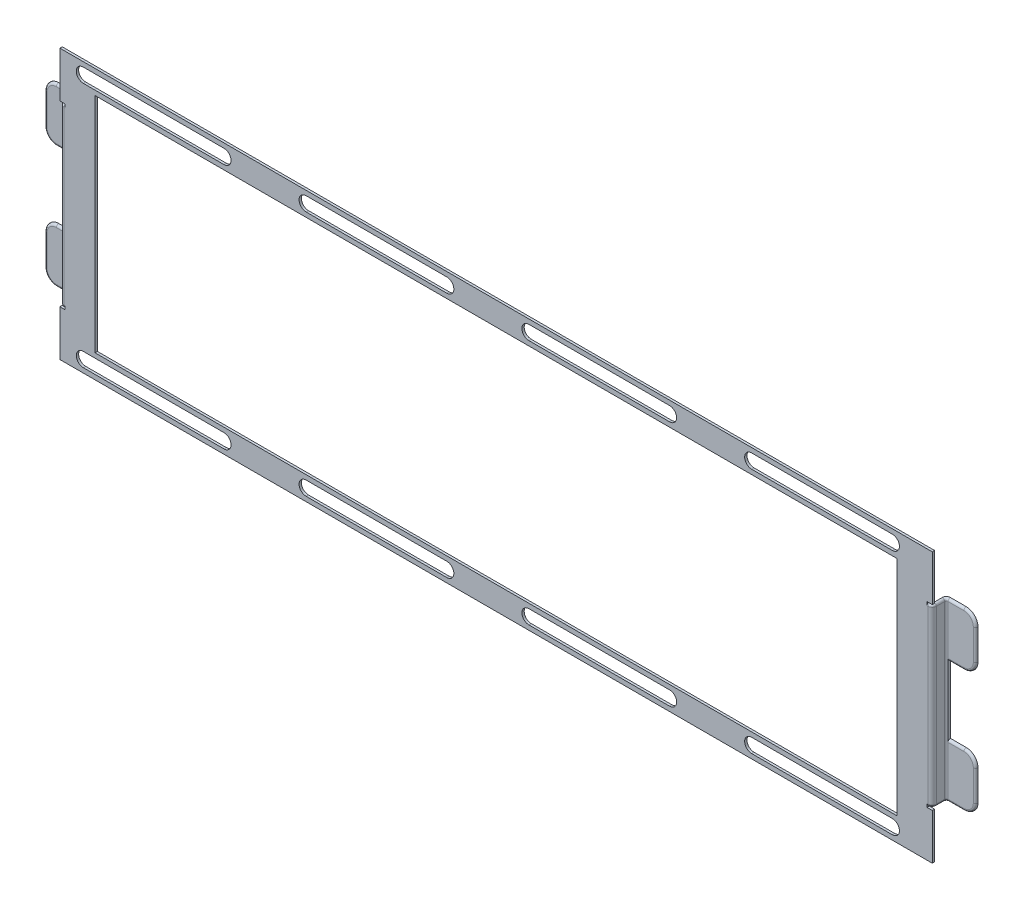
from build123d import *

# Parameters (mm, degrees)
SKETCH_1_W             = 372
SKETCH_1_H             = 115
SM_BASE_FLANGE_1_DEPTH = 1
SKETCH_6_W             = 342
SKETCH_6_H             = 95
CUT_EXTRUDE_1_DEPTH    = 10
CUT_EXTRUDE_2_DEPTH    = 10
PATTERN_LINEAR_1_COUNT = 4
PATTERN_LINEAR_1_PITCH = 95
OTHER_START            = -38
OTHER_1_DEPTH          = 76
OTHER_1_2_DEPTH        = 0.5
OTHER_START_2          = 37.5
OTHER_1_3_DEPTH        = 0.5
OTHER_START_3          = -37.5
OTHER_1_4_DEPTH        = 75
SKETCH_15_W            = 11.7634
SKETCH_15_H            = 29
CUT_EXTRUDE_3_DEPTH    = 10
FILLET_1_R             = 5
FILLET_2_R             = 1
FILLET_1_OF_MIRROR_1_R = 5
FILLET_2_OF_MIRROR_1_R = 1


# Read off the part's stored shape, not the designer's step: 斜接法兰1
# Sheet-metal steps are written as plain solids
with BuildPart() as part:
    # Sketch 1 → 基体-法兰1 (new body)
    with BuildSketch(Plane.XY):
        Rectangle(SKETCH_1_W, SKETCH_1_H)
    extrude(amount=-SM_BASE_FLANGE_1_DEPTH)

    # 草图6 → 切除-拉伸1 (cut)
    with BuildSketch(Plane.XY):
        Rectangle(SKETCH_6_W, SKETCH_6_H)
    extrude(amount=-CUT_EXTRUDE_1_DEPTH, mode=Mode.SUBTRACT)

    # 草图7 → 切除-拉伸2 (cut)
    with BuildSketch(Plane.XY):
        with BuildLine():
            Line((-176, 55.5), (-116, 55.5))
            ThreePointArc((-116, 55.5), (-113, 52.5), (-116, 49.5))
            Line((-116, 49.5), (-176, 49.5))
            ThreePointArc((-176, 49.5), (-179, 52.5), (-176, 55.5))
        make_face()
        with BuildLine():
            Line((-176, -55.5), (-116, -55.5))
            ThreePointArc((-116, -55.5), (-113, -52.5), (-116, -49.5))
            Line((-116, -49.5), (-176, -49.5))
            ThreePointArc((-176, -49.5), (-179, -52.5), (-176, -55.5))
        make_face()
    cut_extrude_2 = extrude(amount=-CUT_EXTRUDE_2_DEPTH, mode=Mode.SUBTRACT)

    # 阵列(线性)1: 切除-拉伸2 ×4
    with Locations(*[(i * PATTERN_LINEAR_1_PITCH, 0, 0) for i in range(1, PATTERN_LINEAR_1_COUNT)]):
        add(cut_extrude_2, mode=Mode.SUBTRACT)

    # Other 1 outline → Other 1 (cut)
    with BuildSketch(Plane(origin=(0, 0, 0), x_dir=(1, 0, 0), z_dir=(0, 1, 0)).offset(OTHER_START)):
        with BuildLine():
            Line((186, 1), (185.83604109, 1))
            ThreePointArc((185.83604109, 1), (185.195226164, 0.271171885), (184.2634, 0))
            Line((184.2634, 0), (186, 0))
            Line((186, 0), (186, 1))
        make_face()
    other_1 = extrude(amount=OTHER_1_DEPTH, mode=Mode.SUBTRACT)

    # Other 1 2 outline → Other 1 2 (cut)
    with BuildSketch(Plane(origin=(0, 0, 0), x_dir=(1, 0, 0), z_dir=(0, 1, 0)).offset(OTHER_START)):
        with BuildLine():
            ThreePointArc((184.2634, 0), (185.195226164, 0.271171885), (185.83604109, 1))
            Line((185.83604109, 1), (183.7634, 1))
            Line((183.7634, 1), (183.7634, 0))
            Line((183.7634, 0), (184.2634, 0))
        make_face()
    other_1_2 = extrude(amount=OTHER_1_2_DEPTH, mode=Mode.SUBTRACT)

    # Other 1 3 outline → Other 1 3 (cut)
    with BuildSketch(Plane(origin=(0, 0, 0), x_dir=(1, 0, 0), z_dir=(0, 1, 0)).offset(OTHER_START_2)):
        with BuildLine():
            ThreePointArc((184.2634, 0), (185.195226164, 0.271171885), (185.83604109, 1))
            Line((185.83604109, 1), (183.7634, 1))
            Line((183.7634, 1), (183.7634, 0))
            Line((183.7634, 0), (184.2634, 0))
        make_face()
    other_1_3 = extrude(amount=OTHER_1_3_DEPTH, mode=Mode.SUBTRACT)

    # Other 1 4 outline → Other 1 4 (add)
    with BuildSketch(Plane(origin=(0, 0, 0), x_dir=(1, 0, 0), z_dir=(0, 1, 0)).offset(OTHER_START_3)):
        with BuildLine():
            Line((186, 1.7366), (186, 5.2634))
            ThreePointArc((186, 5.2634), (186.215745145, 5.784254855), (186.7366, 6))
            Line((186.7366, 6), (198.5, 6))
            Line((198.5, 6), (198.5, 7))
            Line((198.5, 7), (186.7366, 7))
            ThreePointArc((186.7366, 7), (185.508638364, 6.491361636), (185, 5.2634))
            Line((185, 5.2634), (185, 1.7366))
            ThreePointArc((185, 1.7366), (184.784254855, 1.215745145), (184.2634, 1))
            Line((184.2634, 1), (185.83604109, 1))
            ThreePointArc((185.83604109, 1), (185.958514757, 1.359286442), (186, 1.7366))
        make_face()
    other_1_4 = extrude(amount=OTHER_1_4_DEPTH)

    # 草图15 → 切除-拉伸3 (cut)
    with BuildSketch(Plane(origin=(0, 0, -7), x_dir=(-1, 0, 0), z_dir=(0, 0, -1))):
        with Locations((-192.6183, 0)):
            Rectangle(SKETCH_15_W, SKETCH_15_H)
    cut_extrude_3 = extrude(amount=-CUT_EXTRUDE_3_DEPTH, mode=Mode.SUBTRACT)

    # 圆角1
    fillet_1_edges = [part.edges().sort_by_distance(p)[0] for p in [
        (198.5, -37.5, -6.5),
        (198.5, 37.5, -6.5),
        (198.5, -14.5, -6.5),
        (198.5, 14.5, -6.5),
    ]]
    fillet(fillet_1_edges, radius=FILLET_1_R)

    # 圆角2
    fillet_2_edges = [part.edges().sort_by_distance(p)[0] for p in [
        (184.0134, -37.5, 0),
        (184.0134, 37.5, 0),
        (186, -37.5, -3.5),
        (186, 37.5, -3.5),
        (186.215745145, 37.5, -5.784254855),
        (186.215745145, -37.5, -5.784254855),
        (190.1183, -37.5, -6),
        (185.195226164, -37.5, -0.271171885),
        (185.195226164, 37.5, -0.271171885),
        (190.1183, -14.5, -6),
        (198.5, 26, -6),
        (190.1183, 14.5, -6),
        (190.1183, 37.5, -6),
        (197.035533906, 36.035533906, -6),
        (197.035533906, 15.964466094, -6),
        (198.5, -26, -6),
        (197.035533906, -15.964466094, -6),
        (197.035533906, -36.035533906, -6),
    ]]
    fillet(fillet_2_edges, radius=FILLET_2_R - 0.0001)  # a hair under: the kernel refuses the full size

    # 镜向1: Other 1, Other 1 2, Other 1 3, Other 1 4, 切除-拉伸3 across plane
    add(other_1.mirror(Plane(origin=(0, 0, 0), x_dir=(0, 0, 1), z_dir=(1, 0, 0))), mode=Mode.SUBTRACT)
    add(other_1_2.mirror(Plane(origin=(0, 0, 0), x_dir=(0, 0, 1), z_dir=(1, 0, 0))), mode=Mode.SUBTRACT)
    add(other_1_3.mirror(Plane(origin=(0, 0, 0), x_dir=(0, 0, 1), z_dir=(1, 0, 0))), mode=Mode.SUBTRACT)
    add(other_1_4.mirror(Plane(origin=(0, 0, 0), x_dir=(0, 0, 1), z_dir=(1, 0, 0))))
    add(cut_extrude_3.mirror(Plane(origin=(0, 0, 0), x_dir=(0, 0, 1), z_dir=(1, 0, 0))), mode=Mode.SUBTRACT)

    # 圆角1 of 镜向1
    fillet_1_of_mirror_1_edges = [part.edges().sort_by_distance(p)[0] for p in [
        (-198.5, -37.5, -6.5),
        (-198.5, 37.5, -6.5),
        (-198.5, -14.5, -6.5),
        (-198.5, 14.5, -6.5),
    ]]
    fillet(fillet_1_of_mirror_1_edges, radius=FILLET_1_OF_MIRROR_1_R)

    # 圆角2 of 镜向1
    fillet_2_of_mirror_1_edges = [part.edges().sort_by_distance(p)[0] for p in [
        (-184.0134, -37.5, 0),
        (-184.0134, 37.5, 0),
        (-186, -37.5, -3.5),
        (-186, 37.5, -3.5),
        (-186.215745145, 37.5, -5.784254855),
        (-186.215745145, -37.5, -5.784254855),
        (-190.1183, -37.5, -6),
        (-185.195226164, -37.5, -0.271171885),
        (-185.195226164, 37.5, -0.271171885),
        (-190.1183, -14.5, -6),
        (-198.5, 26, -6),
        (-190.1183, 14.5, -6),
        (-190.1183, 37.5, -6),
        (-197.035533906, 36.035533906, -6),
        (-197.035533906, 15.964466094, -6),
        (-198.5, -26, -6),
        (-197.035533906, -15.964466094, -6),
        (-197.035533906, -36.035533906, -6),
    ]]
    fillet(fillet_2_of_mirror_1_edges, radius=FILLET_2_OF_MIRROR_1_R - 0.0001)  # a hair under: the kernel refuses the full size


solid = part.part
